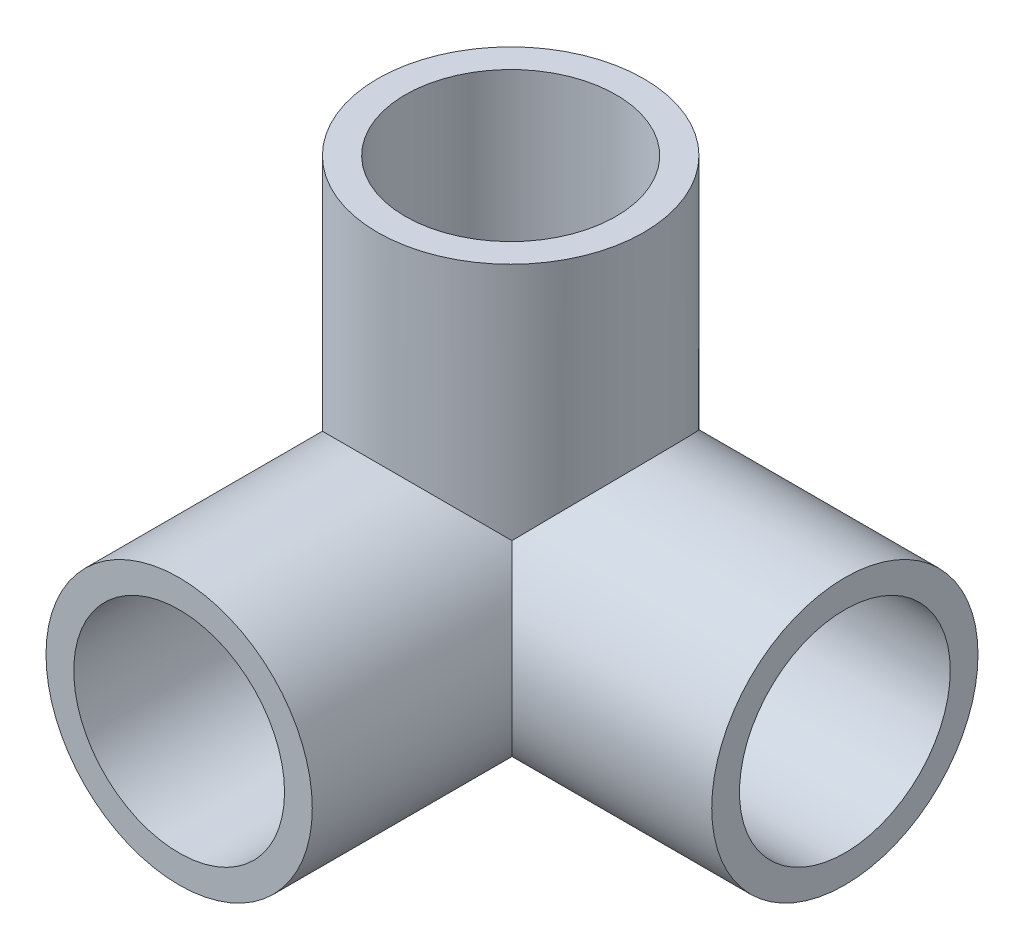
from build123d import *

# Parameters (mm, degrees)
SKETCH3_R           = 30.48
SKETCH3_R_2         = 24.13
BOSS_EXTRUDE1_REACH = 212.796
BOSS_EXTRUDE1_START = 76.2
SKETCH4_R           = 30.48
SKETCH4_R_2         = 24.13


with BuildPart() as part:
    # Sweep1: sweep along a path in Sketch2
    with BuildLine(Plane(origin=(0, 0, 0), x_dir=(1, 0, 0), z_dir=(0, 1, 0))) as sweep1_path:
        Line((0, 0), (0, 76.2))
        Line((0, 76.2), (76.2, 76.2))
    # Sketch3 → Sweep1 (sweep)
    with BuildSketch(Plane.XY):
        Circle(SKETCH3_R)
        Circle(SKETCH3_R_2, mode=Mode.SUBTRACT)
    sweep(path=sweep1_path.line, transition=Transition.RIGHT)

    # Sketch4 → Boss-Extrude1 (add, up to next)
    with BuildSketch(Plane(origin=(0, 0, 0), x_dir=(1, 0, 0), z_dir=(0, 1, 0)).offset(BOSS_EXTRUDE1_START), mode=Mode.PRIVATE) as boss_extrude1_sk1:
        with Locations((0, 75.898260474)):
            Circle(SKETCH4_R)
        with Locations((0, 75.898260474)):
            Circle(SKETCH4_R_2, mode=Mode.SUBTRACT)
    boss_extrude1_tool1 = extrude(boss_extrude1_sk1.sketch, amount=-BOSS_EXTRUDE1_REACH, mode=Mode.PRIVATE) - part.part
    add(boss_extrude1_tool1.solids().sort_by_distance((-29.617895, 76.2, -75.89826))[0])


solid = part.part
